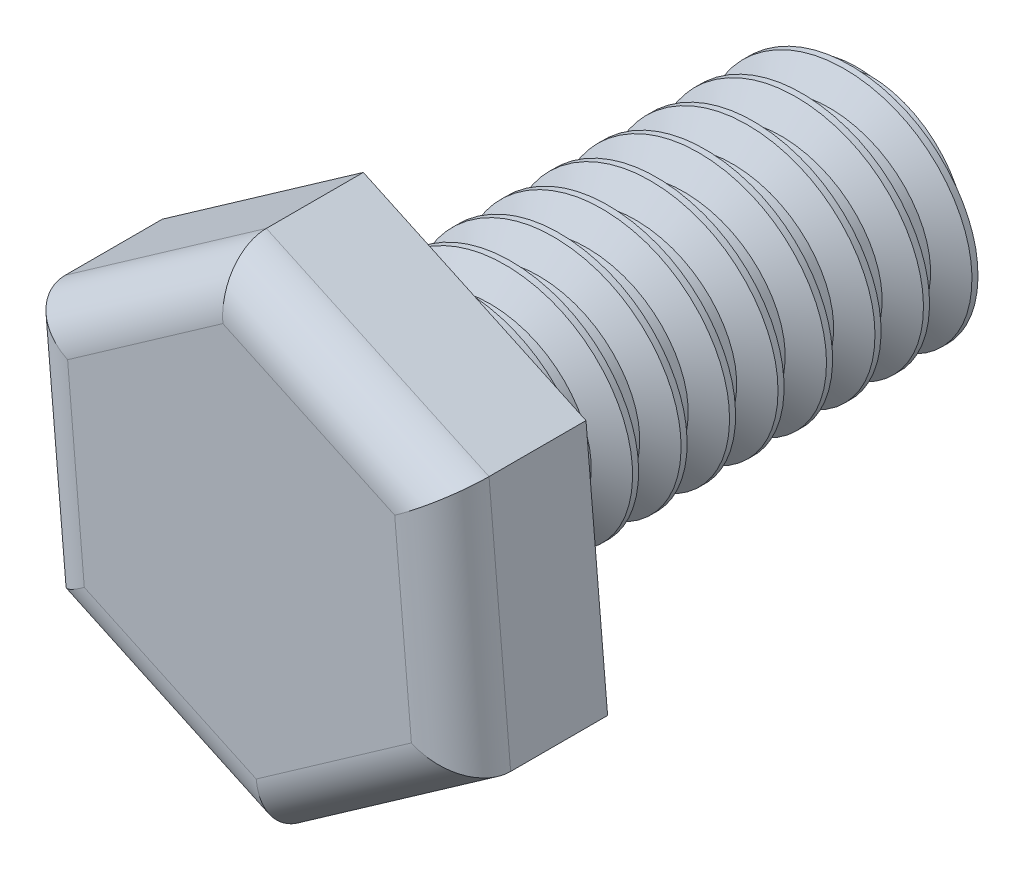
from build123d import *

# Parameters (mm, degrees)
SKETCH1_R           = 2
BOSS_EXTRUDE1_DEPTH = 10
SKETCH2_R           = 5.065409668
BOSS_EXTRUDE2_DEPTH = 3
SKETCH3_OUTSIDE_W   = 16
SKETCH3_OUTSIDE_H   = 16
CUT_EXTRUDE1_DEPTH  = 3
FILLET1_R           = 1
THREAD1_PITCH       = 1
SKETCH8_R           = 3.988177885
CUT_EXTRUDE2_DEPTH  = 3


with BuildPart() as part:
    # Sketch1 → Boss-Extrude1 (new body)
    with BuildSketch(Plane.XY):
        Circle(SKETCH1_R)
    extrude(amount=BOSS_EXTRUDE1_DEPTH)

    # Sketch2 → Boss-Extrude2 (add)
    with BuildSketch(Plane.XY.offset(10)):
        Circle(SKETCH2_R)
    extrude(amount=BOSS_EXTRUDE2_DEPTH)

    # Sketch3 outside → Cut-Extrude1 (cut)
    with BuildSketch(Plane.XY.offset(13)):
        Rectangle(SKETCH3_OUTSIDE_W, SKETCH3_OUTSIDE_H)
        Polygon((4.59268551, -2.136729956), (4.146805178, 2.909017345), (-0.445880332, 5.045747302), (-4.59268551, 2.136729956), (-4.146805178, -2.909017345), (0.445880332, -5.045747302), align=None, mode=Mode.SUBTRACT)
    extrude(amount=-CUT_EXTRUDE1_DEPTH, mode=Mode.SUBTRACT)

    # Fillet1
    fillet1_edges = [part.edges().sort_by_distance(p)[0] for p in [
        (2.519282921, -3.591238629, 13),
        (-1.850462423, -3.977382323, 13),
        (-4.369745344, -0.386143695, 13),
        (-2.519282921, 3.591238629, 13),
        (1.850462423, 3.977382323, 13),
        (4.369745344, 0.386143695, 13),
    ]]
    fillet(fillet1_edges, radius=FILLET1_R)

    # Thread1: the profile of Thread Profile2 profile screwed along a right-hand helix of 11 turns, 8 arcs to a turn; built about Z, then put on its axis
    thread1_z = Axis((0, 0, 0), (0, 0, 1))
    thread1_corners = [(1.9997, 0, -0.000173205), (2.541265875, 0, 0.312499999), (2.541265875, 0, 0.437499999), (1.9997, 0, 0.750173202)]
    with BuildLine(mode=Mode.PRIVATE) as thread1_profile:
        Line(thread1_corners[0], thread1_corners[1])
        Line(thread1_corners[1], thread1_corners[2])
        Line(thread1_corners[2], thread1_corners[3])
        Line(thread1_corners[3], thread1_corners[0])
    thread1_cap = Face(thread1_profile.wire())
    thread1_turn_angles = [0, 22.5, 45, 67.5, 90, 112.5, 135, 157.5, 180, 202.5, 225, 247.5, 270, 292.5, 315, 337.5, 360]
    thread1_turn_weights = [1, 0.9238795325112867, 1, 0.9238795325112867, 1, 0.9238795325112867, 1, 0.9238795325112867, 1, 0.9238795325112867, 1, 0.9238795325112867, 1, 0.9238795325112867, 1, 0.9238795325112867, 1]
    thread1_turn_rails = [Edge.make_bspline([Vector(p[0], p[1], 0).rotate(thread1_z, thread1_turn_angles[k]) / thread1_turn_weights[k] + Vector(0, 0, p[2] + THREAD1_PITCH * thread1_turn_angles[k] / 360) for k in range(17)], [0, 0, 0, 1, 1, 2, 2, 3, 3, 4, 4, 5, 5, 6, 6, 7, 7, 8, 8, 8], 2, thread1_turn_weights) for p in thread1_corners]
    thread1_turn_sides = [Face.make_surface_from_curves(thread1_turn_rails[p[0]], thread1_turn_rails[p[1]]) for p in [(0, 1), (1, 2), (2, 3), (3, 0)]]
    thread1 = Plane(origin=(0, 0, -1), x_dir=(1, 0, 0), z_dir=(0, 0, 1)) * Solid(Shell([*[p.moved(Location((0, 0, THREAD1_PITCH * i))) for i in range(11) for p in thread1_turn_sides], thread1_cap, thread1_cap.rotate(thread1_z, 3960).moved(Location((0, 0, THREAD1_PITCH * 3960 / 360)))]))
    add(thread1)

    # Sketch8 → Cut-Extrude2 (cut)
    with BuildSketch(Plane(origin=(0, 0, 0), x_dir=(-1, 0, 0), z_dir=(0, 0, -1))):
        Circle(SKETCH8_R)
    extrude(amount=CUT_EXTRUDE2_DEPTH, mode=Mode.SUBTRACT)


solid = part.part
